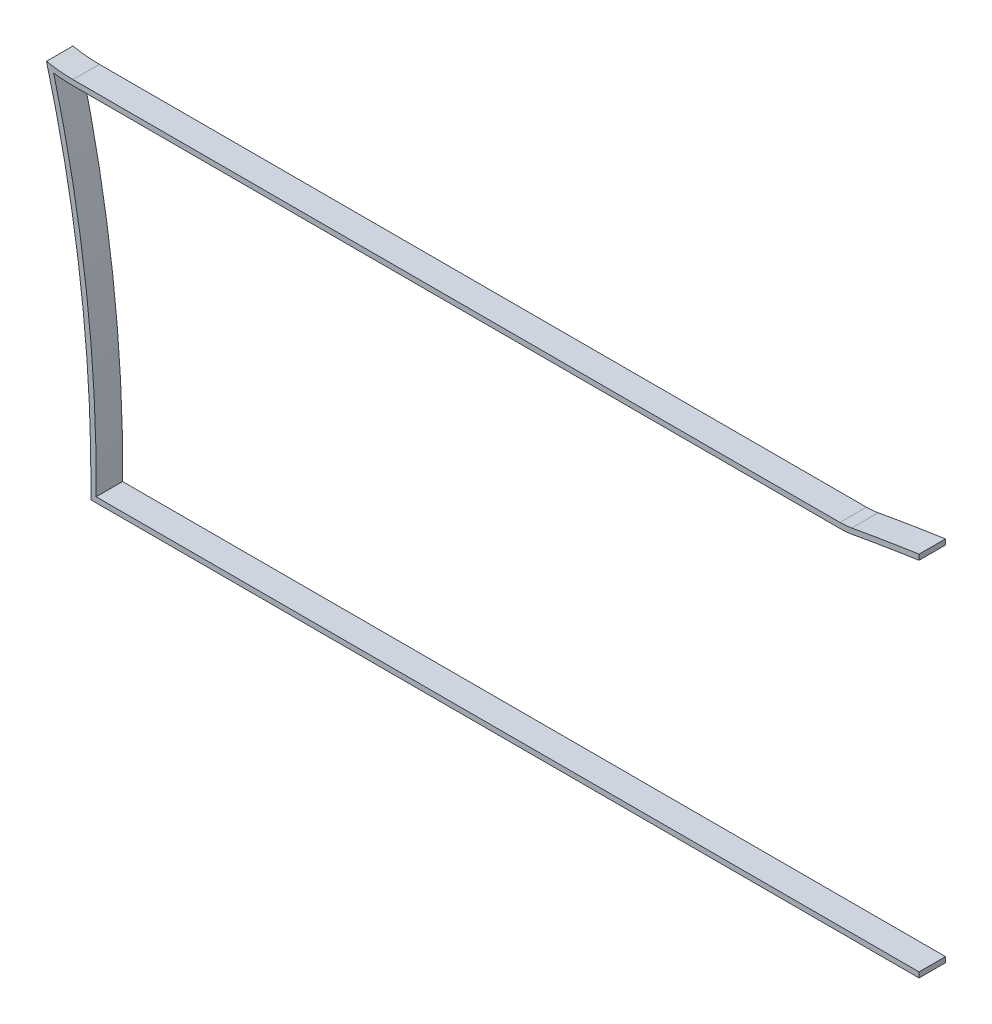
from build123d import *

# Parameters (mm, degrees)
BOSS_EXTRUDE1_DEPTH = 10
SKETCH3_W           = 208.746083537
SKETCH3_H           = 274.535725978
CUT_EXTRUDE1_DEPTH  = 399.651564654


with BuildPart() as part:
    # Sketch2 → Boss-Extrude1 (new body)
    with BuildSketch(Plane.XY.offset(-4)):
        with BuildLine():
            Line((-300, 17.25), (-9.906933746, 17.25))
            ThreePointArc((-9.906933746, 17.25), (-7.67705834, 17.349645471), (-5.464958693, 17.647787546))
            ThreePointArc((-5.464958693, 17.647787546), (173.262167791, 29.246699007), (349.996014284, 0.211065854))
            ThreePointArc((349.996014284, 0.211065854), (359.352395656, -4.784442191), (365.795573071, -13.209549776))
            Line((365.795573071, -13.209549776), (400.384507401, -86.847766013))
            ThreePointArc((400.384507401, -86.847766013), (400.778842945, -87.899120346), (401, -89))
            ThreePointArc((401, -89), (399.447287587, -94.279668904), (394.557793346, -96.805270939))
            ThreePointArc((394.557793346, -96.805270939), (214.863177419, -108.403215094), (35, -117))
            Line((35, -117), (-30.25, -117))
            Line((-30.25, -117), (-293.242078622, -117))
            ThreePointArc((-293.242078622, -117), (-293.197036902, -109.999972274), (-293.25, -103))
            ThreePointArc((-293.25, -103), (-297.900702689, -41.860509444), (-310, 18.25))
            ThreePointArc((-310, 18.25), (-305.024937811, 17.500621894), (-300, 17.25))
        make_face()
        with BuildLine():
            Line((-300, 15.25), (-9.906933746, 15.25))
            ThreePointArc((-9.906933746, 15.25), (-7.498668308, 15.357617109), (-5.109600689, 15.67961055))
            ThreePointArc((-5.109600689, 15.67961055), (173.164177958, 27.249100951), (349.449732641, -1.712882265))
            ThreePointArc((349.449732641, -1.712882265), (358.057603503, -6.308749667), (363.985326724, -14.059848645))
            Line((363.985326724, -14.059848645), (398.574261055, -87.698064882))
            ThreePointArc((398.574261055, -87.698064882), (398.855929301, -88.449032263), (399.013898626, -89.235374873))
            ThreePointArc((399.013898626, -89.235374873), (397.904818331, -93.006566947), (394.412322444, -94.8105684))
            ThreePointArc((394.412322444, -94.8105684), (214.770700526, -106.405257008), (34.960579781, -115))
            Line((34.960579781, -115), (-30.25, -115))
            Line((-30.25, -115), (-291.219119939, -115))
            ThreePointArc((-291.219119939, -115), (-291.198633765, -108.985341109), (-291.250212173, -102.970868486))
            ThreePointArc((-291.250212173, -102.970868486), (-295.709152828, -43.127202467), (-307.277212671, 15.756806448))
            ThreePointArc((-307.277212671, 15.756806448), (-303.647419534, 15.376854871), (-300, 15.25))
        make_face(mode=Mode.SUBTRACT)
    extrude(amount=BOSS_EXTRUDE1_DEPTH)

    # Sketch3 → Cut-Extrude1 (cut, through all)
    with BuildSketch(Plane(origin=(20, 0, 0), x_dir=(0, 0, -1), z_dir=(1, 0, 0))):
        with Locations((3.946589657, -49.091759287)):
            Rectangle(SKETCH3_W, SKETCH3_H)
    extrude(amount=CUT_EXTRUDE1_DEPTH, mode=Mode.SUBTRACT)


solid = part.part
